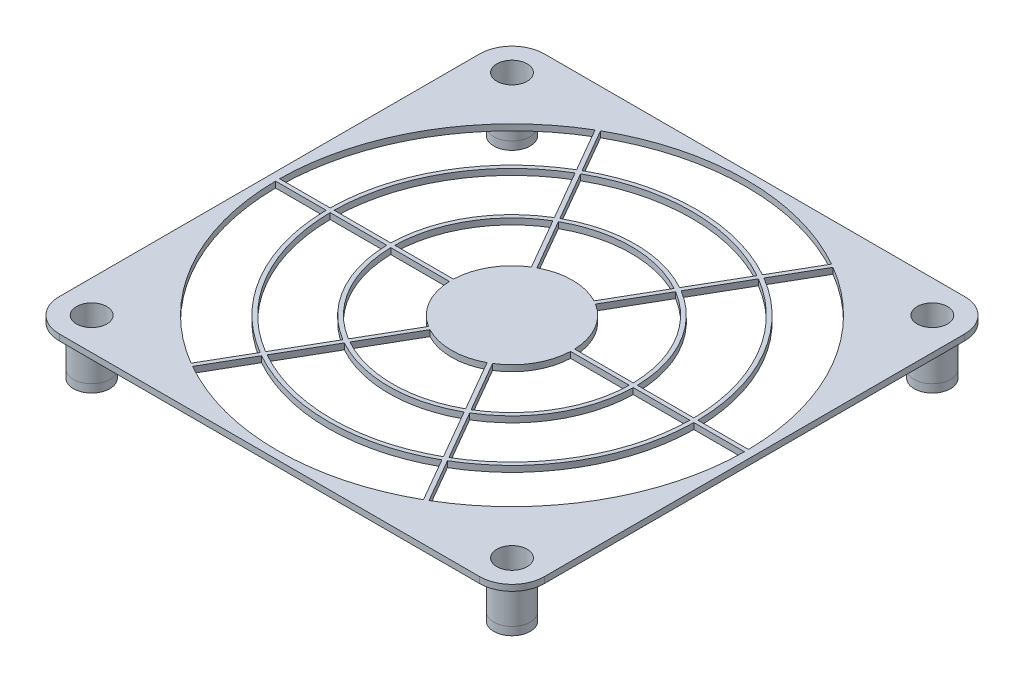
from build123d import *
from build123d.topology import SkipClean

# Parameters (mm, degrees)
SKETCH_1_R        = 3.75
SKETCH_1_R_2      = 58
EXTRUDE_1_DEPTH   = 1.5
EXTRUDE_START     = -1.5
EXTRUDE_1_2_DEPTH = 1.5
EXTRUDE_2_DEPTH   = 1.5
EXTRUDE_START_2   = 10
SKETCH_3_R        = 4.5
SKETCH_3_R_2      = 3.75
EXTRUDE_3_DEPTH   = 10
SKETCH_4_R        = 4.5
SKETCH_4_R_2      = 2.25
EXTRUDE_4_DEPTH   = 2
EXTRUDE_4_2_DEPTH = 2
EXTRUDE_4_3_DEPTH = 2
EXTRUDE_4_4_DEPTH = 2


# Read off the part's stored shape, not the designer's step: 拉伸-薄壁1
with BuildPart() as part:
    # 草图1 → Extrude 1 (new body)
    with BuildSketch(Plane(origin=(0, 0, 0), x_dir=(1, 0, 0), z_dir=(0, 1, 0))):
        with BuildLine():
            Line((-52, 60), (52, 60))
            ThreePointArc((52, 60), (57.656854249, 57.656854249), (60, 52))
            Line((60, 52), (60, -52))
            ThreePointArc((60, -52), (57.656854249, -57.656854249), (52, -60))
            Line((52, -60), (-52, -60))
            ThreePointArc((-52, -60), (-57.656854249, -57.656854249), (-60, -52))
            Line((-60, -52), (-60, 52))
            ThreePointArc((-60, 52), (-57.656854249, 57.656854249), (-52, 60))
        make_face()
        with Locations(Location((52, 52, 0), (0, 0, 270))):
            Circle(SKETCH_1_R, mode=Mode.SUBTRACT)
        with Locations(Location((52, -52, 0), (0, 0, 270))):
            Circle(SKETCH_1_R, mode=Mode.SUBTRACT)
        with Locations(Location((-52, 52, 0), (0, 0, 270))):
            Circle(SKETCH_1_R, mode=Mode.SUBTRACT)
        with Locations(Location((-52, -52, 0), (0, 0, 270))):
            Circle(SKETCH_1_R, mode=Mode.SUBTRACT)
        with Locations(Location((0, 0, 0), (0, 0, 270))):
            Circle(SKETCH_1_R_2, mode=Mode.SUBTRACT)
    extrude(amount=EXTRUDE_1_DEPTH)

    # Extrude 1 2 outline → Extrude 1 2 (add)
    with BuildSketch(Plane.XZ.offset(EXTRUDE_START)):
        with BuildLine():
            Line((57.997844907, 0.499986102), (45.497252664, 0.5))
            ThreePointArc((45.497252664, 0.5), (39.404155872, 22.75), (23.181639034, 39.15177661))
            Line((23.181639034, 39.15177661), (29.431923607, 49.977613716))
            ThreePointArc((29.431923607, 49.977613716), (28.999999948, 50.229473449), (28.565921191, 50.477600443))
            Line((28.565921191, 50.477600443), (22.31561363, 39.65177661))
            ThreePointArc((22.31561363, 39.65177661), (0, 45.5), (-22.31561363, 39.65177661))
            Line((-22.31561363, 39.65177661), (-28.565921191, 50.477600443))
            ThreePointArc((-28.565921191, 50.477600443), (-28.999999948, 50.229473449), (-29.431923607, 49.977613716))
            Line((-29.431923607, 49.977613716), (-23.181639034, 39.15177661))
            ThreePointArc((-23.181639034, 39.15177661), (-39.404155872, 22.75), (-45.497252664, 0.5))
            Line((-45.497252664, 0.5), (-57.997844907, 0.499986102))
            ThreePointArc((-57.997844907, 0.499986102), (-58, 0), (-57.997844907, -0.499986102))
            Line((-57.997844907, -0.499986102), (-45.497252664, -0.5))
            ThreePointArc((-45.497252664, -0.5), (-39.404155872, -22.75), (-23.181639034, -39.15177661))
            Line((-23.181639034, -39.15177661), (-29.431923607, -49.977613716))
            ThreePointArc((-29.431923607, -49.977613716), (-28.999999948, -50.229473449), (-28.565921191, -50.477600443))
            Line((-28.565921191, -50.477600443), (-22.31561363, -39.65177661))
            ThreePointArc((-22.31561363, -39.65177661), (0, -45.5), (22.31561363, -39.65177661))
            Line((22.31561363, -39.65177661), (28.565921191, -50.477600443))
            ThreePointArc((28.565921191, -50.477600443), (28.999999948, -50.229473449), (29.431923607, -49.977613716))
            Line((29.431923607, -49.977613716), (23.181639034, -39.15177661))
            ThreePointArc((23.181639034, -39.15177661), (39.404155872, -22.75), (45.497252664, -0.5))
            Line((45.497252664, -0.5), (57.997844907, -0.499986102))
            ThreePointArc((57.997844907, -0.499986102), (58, 0), (57.997844907, 0.499986102))
        make_face()
        with BuildLine():
            Line((-44.497190923, -0.5), (-30.495901364, -0.5))
            ThreePointArc((-30.495901364, -0.5), (-26.413774815, -15.25), (-15.680963384, -26.160225292))
            Line((-15.680963384, -26.160225292), (-22.681608163, -38.285697736))
            ThreePointArc((-22.681608163, -38.285697736), (-38.538130468, -22.25), (-44.497190923, -0.5))
        make_face(mode=Mode.SUBTRACT)
        with BuildLine():
            Line((-29.495762408, -0.5), (-0.866025404, -0.5))
            Line((-0.866025404, -0.5), (-15.180893906, -25.294079549))
            ThreePointArc((-15.180893906, -25.294079549), (-25.547749412, -14.75), (-29.495762408, -0.5))
        make_face(mode=Mode.SUBTRACT)
        with BuildLine():
            ThreePointArc((21.815582759, -38.785697736), (0, -44.5), (-21.815582759, -38.785697736))
            Line((-21.815582759, -38.785697736), (-14.81493798, -26.660225292))
            ThreePointArc((-14.81493798, -26.660225292), (0, -30.5), (14.81493798, -26.660225292))
            Line((14.81493798, -26.660225292), (21.815582759, -38.785697736))
        make_face(mode=Mode.SUBTRACT)
        with BuildLine():
            Line((-14.314868502, -25.794079549), (0, -1))
            Line((0, -1), (14.314868502, -25.794079549))
            ThreePointArc((14.314868502, -25.794079549), (0, -29.5), (-14.314868502, -25.794079549))
        make_face(mode=Mode.SUBTRACT)
        with BuildLine():
            Line((15.180893906, -25.294079549), (0.866025404, -0.5))
            Line((0.866025404, -0.5), (29.495762408, -0.5))
            ThreePointArc((29.495762408, -0.5), (25.547749412, -14.75), (15.180893906, -25.294079549))
        make_face(mode=Mode.SUBTRACT)
        with BuildLine():
            ThreePointArc((15.680963384, -26.160225292), (26.413774815, -15.25), (30.495901364, -0.5))
            Line((30.495901364, -0.5), (44.497190923, -0.5))
            ThreePointArc((44.497190923, -0.5), (38.538130468, -22.25), (22.681608163, -38.285697736))
            Line((22.681608163, -38.285697736), (15.680963384, -26.160225292))
        make_face(mode=Mode.SUBTRACT)
        with BuildLine():
            ThreePointArc((-15.680963384, 26.160225292), (-26.413774815, 15.25), (-30.495901364, 0.5))
            Line((-30.495901364, 0.5), (-44.497190923, 0.5))
            ThreePointArc((-44.497190923, 0.5), (-38.538130468, 22.25), (-22.681608163, 38.285697736))
            Line((-22.681608163, 38.285697736), (-15.680963384, 26.160225292))
        make_face(mode=Mode.SUBTRACT)
        with BuildLine():
            Line((-15.180893906, 25.294079549), (-0.866025404, 0.5))
            Line((-0.866025404, 0.5), (-29.495762408, 0.5))
            ThreePointArc((-29.495762408, 0.5), (-25.547749412, 14.75), (-15.180893906, 25.294079549))
        make_face(mode=Mode.SUBTRACT)
        with BuildLine():
            Line((29.495762408, 0.5), (0.866025404, 0.5))
            Line((0.866025404, 0.5), (15.180893906, 25.294079549))
            ThreePointArc((15.180893906, 25.294079549), (25.547749412, 14.75), (29.495762408, 0.5))
        make_face(mode=Mode.SUBTRACT)
        with BuildLine():
            Line((14.314868502, 25.794079549), (0, 1))
            Line((0, 1), (-14.314868502, 25.794079549))
            ThreePointArc((-14.314868502, 25.794079549), (0, 29.5), (14.314868502, 25.794079549))
        make_face(mode=Mode.SUBTRACT)
        with BuildLine():
            Line((44.497190923, 0.5), (30.495901364, 0.5))
            ThreePointArc((30.495901364, 0.5), (26.413774815, 15.25), (15.680963384, 26.160225292))
            Line((15.680963384, 26.160225292), (22.681608163, 38.285697736))
            ThreePointArc((22.681608163, 38.285697736), (38.538130468, 22.25), (44.497190923, 0.5))
        make_face(mode=Mode.SUBTRACT)
        with BuildLine():
            ThreePointArc((-21.815582759, 38.785697736), (0, 44.5), (21.815582759, 38.785697736))
            Line((21.815582759, 38.785697736), (14.81493798, 26.660225292))
            ThreePointArc((14.81493798, 26.660225292), (0, 30.5), (-14.81493798, 26.660225292))
            Line((-14.81493798, 26.660225292), (-21.815582759, 38.785697736))
        make_face(mode=Mode.SUBTRACT)
    extrude(amount=EXTRUDE_1_2_DEPTH)

    # 草图2<3> → 凸台-拉伸2 (add)
    with BuildSketch(Plane.XZ):
        with BuildLine():
            Line((-7.5, -12.990381057), (0, 0))
            Line((0, 0), (-15, 0))
            ThreePointArc((-15, 0), (-12.990381057, -7.5), (-7.5, -12.990381057))
        make_face()
        with BuildLine():
            Line((7.5, -12.990381057), (0, 0))
            Line((0, 0), (-7.5, -12.990381057))
            ThreePointArc((-7.5, -12.990381057), (0, -15), (7.5, -12.990381057))
        make_face()
        with BuildLine():
            Line((15, 0), (0, 0))
            Line((0, 0), (7.5, -12.990381057))
            ThreePointArc((7.5, -12.990381057), (12.990381057, -7.5), (15, 0))
        make_face()
        with BuildLine():
            Line((7.5, 12.990381057), (0, 0))
            Line((0, 0), (15, 0))
            ThreePointArc((15, 0), (12.990381057, 7.5), (7.5, 12.990381057))
        make_face()
        with BuildLine():
            Line((-7.5, 12.990381057), (0, 0))
            Line((0, 0), (7.5, 12.990381057))
            ThreePointArc((7.5, 12.990381057), (0, 15), (-7.5, 12.990381057))
        make_face()
        with BuildLine():
            Line((-15, 0), (0, 0))
            Line((0, 0), (-7.5, 12.990381057))
            ThreePointArc((-7.5, 12.990381057), (-12.990381057, 7.5), (-15, 0))
        make_face()
    extrude(amount=-EXTRUDE_2_DEPTH)

    # 草图3 → 凸台-拉伸3 (add)
    # profile 1 of 4: a face of its own
    with SkipClean():  # the faces are left unmerged after this step: merging them gives an invalid solid
        with BuildSketch(Plane.XZ.offset(EXTRUDE_START_2)):
            with Locations(Location((52, 52, 0), (0, 0, 270))):
                Circle(SKETCH_3_R)
            with Locations(Location((52, 52, 0), (0, 0, 270))):
                Circle(SKETCH_3_R_2, mode=Mode.SUBTRACT)
        # profile 2 of 4: a face of its own
        with BuildSketch(Plane.XZ.offset(EXTRUDE_START_2)):
            with Locations(Location((52, -52, 0), (0, 0, 90))):
                Circle(SKETCH_3_R)
            with Locations(Location((52, -52, 0), (0, 0, 90))):
                Circle(SKETCH_3_R_2, mode=Mode.SUBTRACT)
        # profile 3 of 4: a face of its own
        with BuildSketch(Plane.XZ.offset(EXTRUDE_START_2)):
            with Locations(Location((-52, -52, 0), (0, 0, 270))):
                Circle(SKETCH_3_R)
            with Locations(Location((-52, -52, 0), (0, 0, 270))):
                Circle(SKETCH_3_R_2, mode=Mode.SUBTRACT)
        # profile 4 of 4: a face of its own
        with BuildSketch(Plane.XZ.offset(EXTRUDE_START_2)):
            with Locations(Location((-52, 52, 0), (0, 0, 90))):
                Circle(SKETCH_3_R)
            with Locations(Location((-52, 52, 0), (0, 0, 90))):
                Circle(SKETCH_3_R_2, mode=Mode.SUBTRACT)
        extrude(amount=-EXTRUDE_3_DEPTH)


with BuildPart() as body_2:
    # 草图4 → 凸台-拉伸4 (new body)
    with BuildSketch(Plane.XZ.offset(10)):
        with Locations(Location((52, 52, 0), (0, 0, 270))):
            Circle(SKETCH_4_R)
        with Locations(Location((52, 52, 0), (0, 0, 270))):
            Circle(SKETCH_4_R_2, mode=Mode.SUBTRACT)
    extrude(amount=EXTRUDE_4_DEPTH)


with BuildPart() as body_3:
    # 草图4 → Extrude 4 2 (new body)
    with BuildSketch(Plane.XZ.offset(10)):
        with Locations(Location((52, -52, 0), (0, 0, 90))):
            Circle(SKETCH_4_R)
        with Locations(Location((52, -52, 0), (0, 0, 90))):
            Circle(SKETCH_4_R_2, mode=Mode.SUBTRACT)
    extrude(amount=EXTRUDE_4_2_DEPTH)


with BuildPart() as body_4:
    # 草图4 → Extrude 4 3 (new body)
    with BuildSketch(Plane.XZ.offset(10)):
        with Locations(Location((-52, -52, 0), (0, 0, 270))):
            Circle(SKETCH_4_R)
        with Locations(Location((-52, -52, 0), (0, 0, 270))):
            Circle(SKETCH_4_R_2, mode=Mode.SUBTRACT)
    extrude(amount=EXTRUDE_4_3_DEPTH)


with BuildPart() as body_5:
    # 草图4 → Extrude 4 4 (new body)
    with BuildSketch(Plane.XZ.offset(10)):
        with Locations(Location((-52, 52, 0), (0, 0, 90))):
            Circle(SKETCH_4_R)
        with Locations(Location((-52, 52, 0), (0, 0, 90))):
            Circle(SKETCH_4_R_2, mode=Mode.SUBTRACT)
    extrude(amount=EXTRUDE_4_4_DEPTH)


solid = Compound([part.part, body_2.part, body_3.part, body_4.part, body_5.part])
